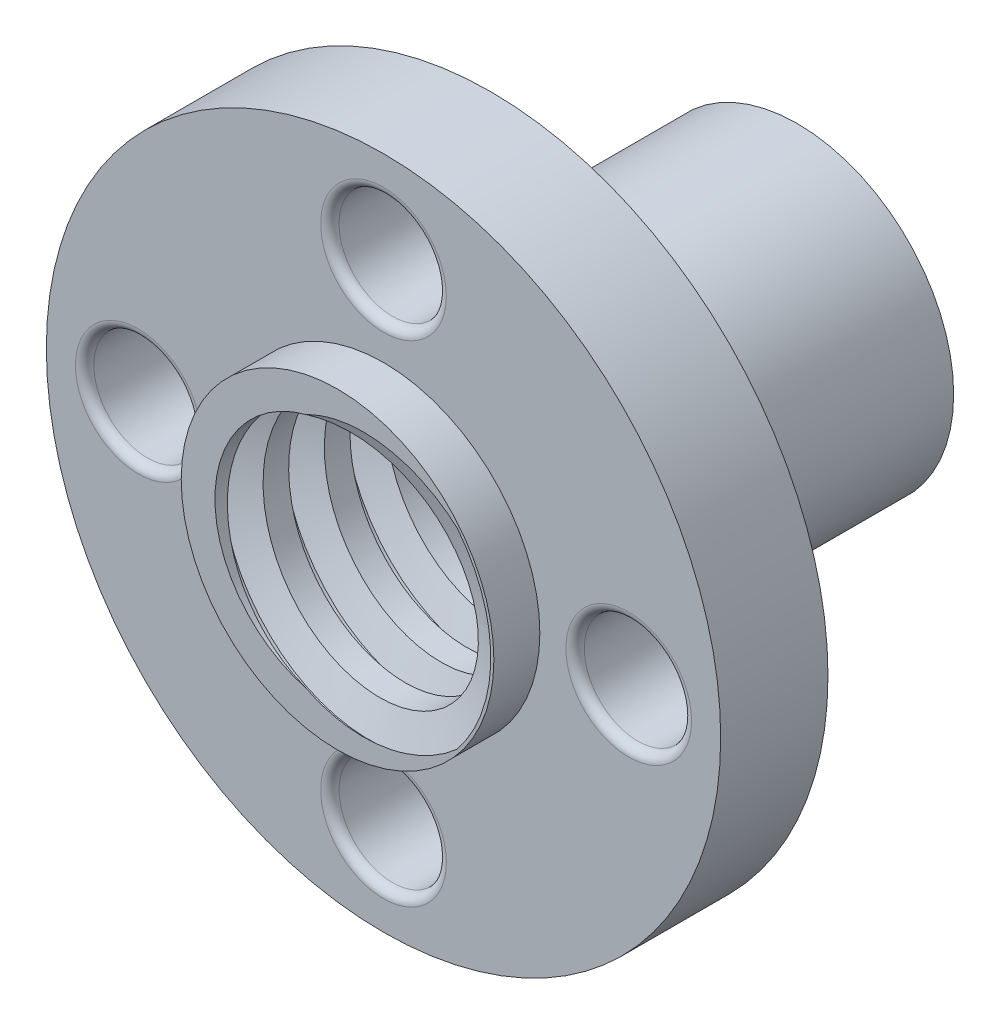
from build123d import *

# Parameters (mm, degrees)
SKETCH1_R                = 11
SKETCH1_R_2              = 5.1
SKETCH1_R_3              = 1.75
BOSS_EXTRUDE1_DEPTH      = 3.5
BOSS_EXTRUDE2_DEPTH      = 1.5
BOSS_EXTRUDE2_DEPTH_BACK = 13.5
SKETCH2_R                = 5.1
SKETCH2_R_2              = 4
CUT_SWEEP1_PITCH         = 2
FILLET2_R                = 0.3


with BuildPart() as part:
    # Sketch1 → Boss-Extrude1 (new body)
    with BuildSketch(Plane.XY):
        Circle(SKETCH1_R)
        Circle(SKETCH1_R_2, mode=Mode.SUBTRACT)
        with Locations((0, 8)):
            Circle(SKETCH1_R_3, mode=Mode.SUBTRACT)
        with Locations((8, 0)):
            Circle(SKETCH1_R_3, mode=Mode.SUBTRACT)
        with Locations((0, -8)):
            Circle(SKETCH1_R_3, mode=Mode.SUBTRACT)
        with Locations((-8, 0)):
            Circle(SKETCH1_R_3, mode=Mode.SUBTRACT)
    extrude(amount=-BOSS_EXTRUDE1_DEPTH)

    # Sketch2 → Boss-Extrude2 (add, two sides: drawn at the far end of the back side and taken through both)
    with BuildSketch(Plane.XY.offset(-BOSS_EXTRUDE2_DEPTH_BACK)):
        Circle(SKETCH2_R)
        Circle(SKETCH2_R_2, mode=Mode.SUBTRACT)
    extrude(amount=BOSS_EXTRUDE2_DEPTH + BOSS_EXTRUDE2_DEPTH_BACK)

    # Cut-Sweep1: arcs per turn and ends read off the stored shape
    # Cut-Sweep1: the profile of Sketch4 screwed along a right-hand helix through 9 turns, 10 arcs to a turn; built about Z, then put on its axis
    cut_sweep1_z = Axis((0, 0, 0), (0, 0, 1))
    cut_sweep1_corners = [(3, 0, -1.05), (3, 0, -2.95), (5, 0, -2.214588815), (5, 0, -1.785411185)]
    with BuildLine(mode=Mode.PRIVATE) as cut_sweep1_profile:
        Line(cut_sweep1_corners[0], cut_sweep1_corners[1])
        Line(cut_sweep1_corners[1], cut_sweep1_corners[2])
        Line(cut_sweep1_corners[2], cut_sweep1_corners[3])
        Line(cut_sweep1_corners[3], cut_sweep1_corners[0])
    cut_sweep1_cap = Face(cut_sweep1_profile.wire())
    cut_sweep1_turn_angles = [0, 18, 36, 54, 72, 90, 108, 126, 144, 162, 180, 198, 216, 234, 252, 270, 288, 306, 324, 342, 360]
    cut_sweep1_turn_weights = [1, 0.9510565162951535, 1, 0.9510565162951535, 1, 0.9510565162951535, 1, 0.9510565162951535, 1, 0.9510565162951535, 1, 0.9510565162951535, 1, 0.9510565162951535, 1, 0.9510565162951535, 1, 0.9510565162951535, 1, 0.9510565162951535, 1]
    cut_sweep1_turn_rails = [Edge.make_bspline([Vector(p[0], p[1], 0).rotate(cut_sweep1_z, cut_sweep1_turn_angles[k]) / cut_sweep1_turn_weights[k] + Vector(0, 0, p[2] + CUT_SWEEP1_PITCH * cut_sweep1_turn_angles[k] / 360) for k in range(21)], [0, 0, 0, 1, 1, 2, 2, 3, 3, 4, 4, 5, 5, 6, 6, 7, 7, 8, 8, 9, 9, 10, 10, 10], 2, cut_sweep1_turn_weights) for p in cut_sweep1_corners]
    cut_sweep1_turn_sides = [Face.make_surface_from_curves(cut_sweep1_turn_rails[p[0]], cut_sweep1_turn_rails[p[1]]) for p in [(0, 1), (1, 2), (2, 3), (3, 0)]]
    cut_sweep1 = Plane(origin=(0, 0, 1.5), x_dir=(1, 0, 0), z_dir=(0, 0, -1)) * Solid(Shell([*[p.moved(Location((0, 0, CUT_SWEEP1_PITCH * i))) for i in range(9) for p in cut_sweep1_turn_sides], cut_sweep1_cap, cut_sweep1_cap.rotate(cut_sweep1_z, 3240).moved(Location((0, 0, CUT_SWEEP1_PITCH * 3240 / 360)))]))
    add(cut_sweep1, mode=Mode.SUBTRACT)

    # Fillet2
    fillet2_edges = [part.edges().sort_by_distance(p)[0] for p in [
        (6.25, 0, 0),
        (-1.75, -8, 0),
        (-9.75, 0, 0),
        (-1.75, 8, 0),
    ]]
    fillet(fillet2_edges, radius=FILLET2_R)


solid = part.part
